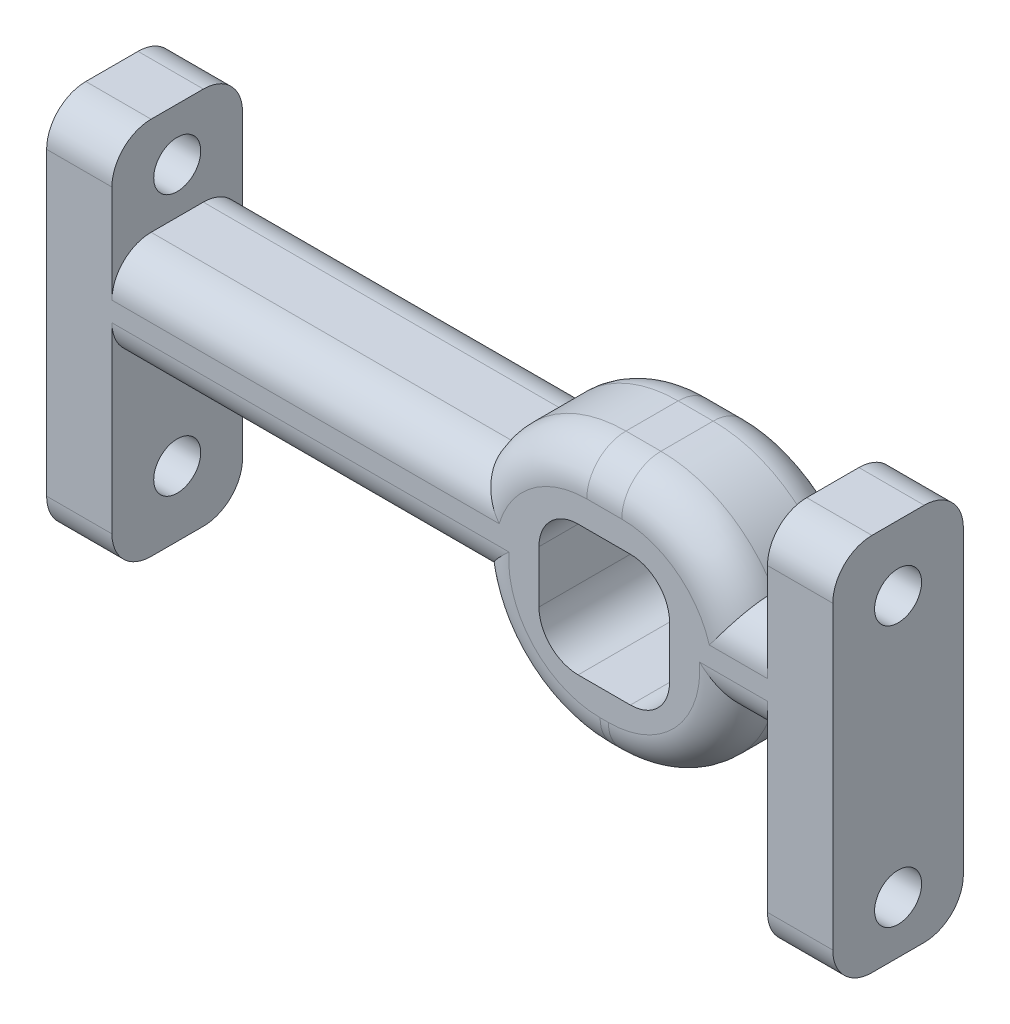
from build123d import *

# Parameters (mm, degrees)
ESQUISSE1_W             = 10
ESQUISSE1_H             = 10
BOSS_EXTRU_1_DEPTH      = 10
CONG_1_R                = 10
CONG_2_R                = 3
ESQUISSE2_R             = 1.8
ENL_V_MAT_EXTRU_1_DEPTH = 5
ESQUISSE3_R             = 1.8
ENL_V_MAT_EXTRU_2_DEPTH = 10
CONG_3_R                = 3


with BuildPart() as part:
    # Esquisse1 → Boss.-Extru.1 (new body)
    with BuildSketch(Plane.XY):
        Polygon((5, 29), (0, 29), (0, 0), (5, 0), (5, 14), (32.7, 14), (32.7, 6.5), (52.7, 6.5), (52.7, 14), (55.2, 14), (55.2, 0), (60.2, 0), (60.2, 29), (55.2, 29), (55.2, 21.5), (52.7, 21.5), (52.7, 26.5), (32.7, 26.5), (32.7, 21.5), (5, 21.5), align=None)
        with Locations((42.7, 16.5)):
            Rectangle(ESQUISSE1_W, ESQUISSE1_H, mode=Mode.SUBTRACT)
    extrude(amount=BOSS_EXTRU_1_DEPTH)

    # Congé1
    # the kernel refuses this fillet: 10 mm, written as the material it takes off along each edge
    with BuildSketch(Plane(origin=(52.7, 6.5, -24.206145914), x_dir=(-1, 0, 0), z_dir=(0, 0, 1))) as cong_1_piece_1:
        with BuildLine():
            CenterArc((9.682458366, -10), CONG_1_R, 90, 75.522487814)
            Line((0, -7.5), (-0.193649167, -7.45))
            ThreePointArc((-0.193649167, -7.45), (-0.2, -3.75), (-0.2, 0))
            Line((-0.2, 0), (0, 0.2))
            Line((0, 0.2), (9.682458366, 0.2))
            Line((9.682458366, 0.2), (9.682458366, 0))
        make_face()
    extrude(amount=58.412291828, mode=Mode.SUBTRACT)
    with BuildSketch(Plane(origin=(32.7, 6.5, -24.206145914), x_dir=(0, 1, 0), z_dir=(0, 0, 1))) as cong_1_piece_2:
        with BuildLine():
            CenterArc((10, -9.682458366), CONG_1_R, 104.477512186, 75.522487814)
            Line((0, -9.682458366), (-0.2, -9.682458366))
            Line((-0.2, -9.682458366), (-0.2, 0))
            Line((-0.2, 0), (0, 0.2))
            ThreePointArc((0, 0.2), (3.75, 0.2), (7.45, 0.193649167))
            Line((7.45, 0.193649167), (7.5, 0))
        make_face()
    extrude(amount=58.412291828, mode=Mode.SUBTRACT)
    with BuildSketch(Plane(origin=(52.7, 26.5, -21.650635095), x_dir=(0, -1, 0), z_dir=(0, 0, 1))) as cong_1_piece_3:
        with BuildLine():
            CenterArc((10, -8.660254038), CONG_1_R, 120, 60)
            Line((0, -8.660254038), (-0.2, -8.660254038))
            Line((-0.2, -8.660254038), (-0.2, 0))
            Line((-0.2, 0), (0, 0.2))
            ThreePointArc((0, 0.2), (2.5, 0.2), (4.9, 0.173205081))
            Line((4.9, 0.173205081), (5, 0))
        make_face()
    extrude(amount=53.301270189, mode=Mode.SUBTRACT)
    with BuildSketch(Plane(origin=(32.7, 26.5, -21.650635095), x_dir=(1, 0, 0), z_dir=(0, 0, 1))) as cong_1_piece_4:
        with BuildLine():
            CenterArc((8.660254038, -10), CONG_1_R, 90, 60)
            Line((0, -5), (-0.173205081, -4.9))
            ThreePointArc((-0.173205081, -4.9), (-0.2, -2.5), (-0.2, 0))
            Line((-0.2, 0), (0, 0.2))
            Line((0, 0.2), (8.660254038, 0.2))
            Line((8.660254038, 0.2), (8.660254038, 0))
        make_face()
    extrude(amount=53.301270189, mode=Mode.SUBTRACT)

    # Congé2
    cong_2_edges = [part.edges().sort_by_distance(p)[0] for p in [
        (47.7, 21.5, 5),
        (37.7, 21.5, 5),
        (37.7, 11.5, 5),
        (47.7, 11.5, 5),
    ]]
    fillet(cong_2_edges, radius=CONG_2_R)

    # Esquisse2 → Enlèv. mat.-Extru.1 (cut)
    with BuildSketch(Plane(origin=(60.2, 0, 0), x_dir=(0, 0, -1), z_dir=(1, 0, 0))):
        with Locations(Location((-5, 24, 0), (0, 0, 90))):
            Circle(ESQUISSE2_R)
        with Locations(Location((-5, 4, 0), (0, 0, 90))):
            Circle(ESQUISSE2_R)
    extrude(amount=-ENL_V_MAT_EXTRU_1_DEPTH, mode=Mode.SUBTRACT)

    # Esquisse3 → Enlèv. mat.-Extru.2 (cut)
    with BuildSketch(Plane.ZY):
        with Locations(Location((5, 25, 0), (0, 0, 270))):
            Circle(ESQUISSE3_R)
        with Locations(Location((5, 5, 0), (0, 0, 270))):
            Circle(ESQUISSE3_R)
    extrude(amount=-ENL_V_MAT_EXTRU_2_DEPTH, mode=Mode.SUBTRACT)

    # Congé3
    cong_3_edges = [part.edges().sort_by_distance(p)[0] for p in [
        (53.95, 14, 10),
        (57.7, 0, 10),
        (18.85, 14, 0),
        (2.5, 0, 0),
        (2.5, 29, 0),
        (57.7, 29, 10),
        (18.85, 21.5, 0),
        (53.95, 21.5, 0),
        (57.7, 29, 0),
        (57.7, 0, 0),
        (53.95, 14, 0),
        (53.95, 21.5, 10),
        (18.85, 21.5, 10),
        (2.5, 29, 10),
        (42.7, 6.5, 0),
        (42.7, 26.5, 0),
        (36.360254038, 25.160254038, 0),
        (49.039745962, 25.160254038, 0),
        (2.5, 0, 10),
        (36.258734009, 8.59430585, 0),
        (49.141265991, 8.59430585, 0),
        (42.7, 6.5, 10),
        (42.7, 26.5, 10),
        (36.360254038, 25.160254038, 10),
        (49.039745962, 25.160254038, 10),
        (36.258734009, 8.59430585, 10),
        (18.85, 14, 10),
        (49.141265991, 8.59430585, 10),
    ]]
    fillet(cong_3_edges, radius=CONG_3_R)


solid = part.part
